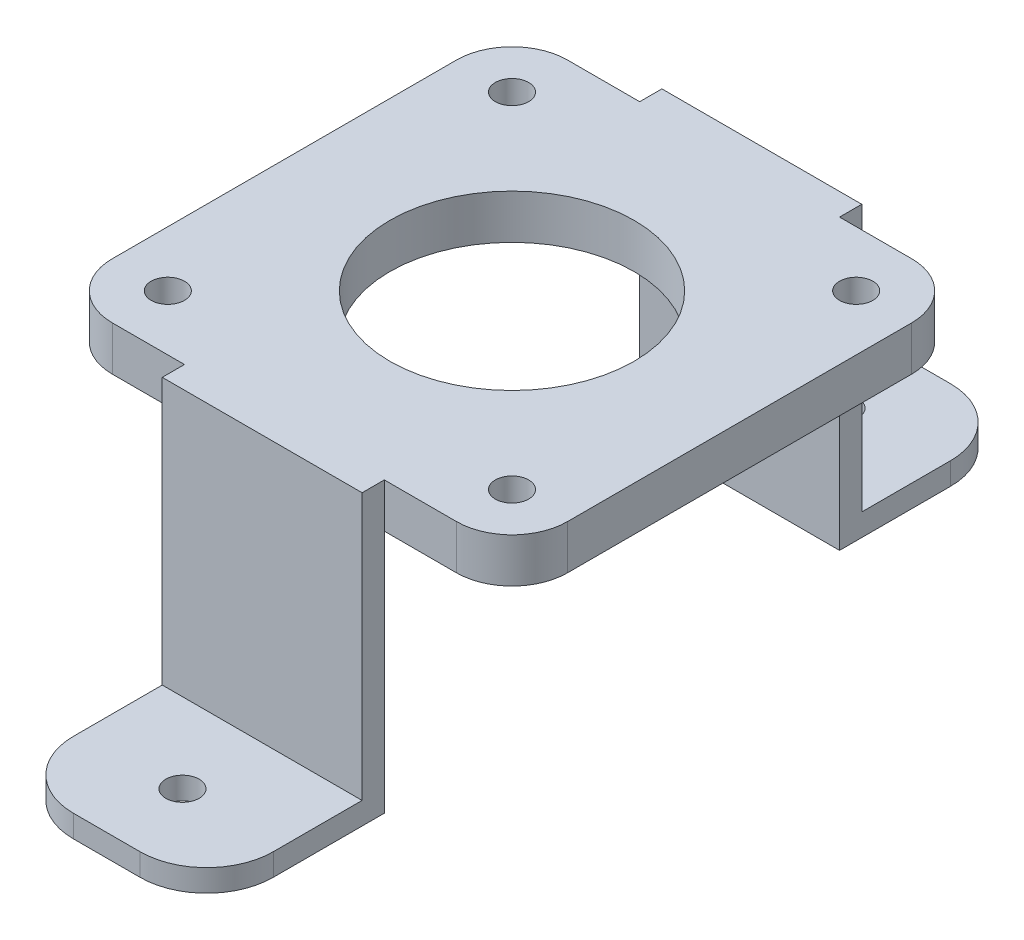
from build123d import *

# Parameters (mm, degrees)
SKETCH_2_R          = 11
SKETCH_2_R_2        = 1.5
EXTRUDE_1_DEPTH     = 4
SKETCH_3_W          = 18
SKETCH_3_H          = 26
EXTRUDE_2_DEPTH     = 2
EXTRUDE_3_DEPTH     = 2
SKETCH_5_R          = 1.5
CUT_EXTRUDE_1_DEPTH = 49.254533466


with BuildPart() as part:
    # Эскиз2 → Бобышка-Вытянуть1 (new body)
    with BuildSketch(Plane(origin=(0, 0, 0), x_dir=(1, 0, 0), z_dir=(0, 1, 0))):
        with BuildLine():
            Line((-15.5, -20.5), (15.5, -20.5))
            ThreePointArc((15.5, -20.5), (19.035533906, -19.035533906), (20.5, -15.5))
            Line((20.5, -15.5), (20.5, 15.5))
            ThreePointArc((20.5, 15.5), (19.035533906, 19.035533906), (15.5, 20.5))
            Line((15.5, 20.5), (-15.5, 20.5))
            ThreePointArc((-15.5, 20.5), (-19.035533906, 19.035533906), (-20.5, 15.5))
            Line((-20.5, 15.5), (-20.5, -15.5))
            ThreePointArc((-20.5, -15.5), (-19.035533906, -19.035533906), (-15.5, -20.5))
        make_face()
        Circle(SKETCH_2_R, mode=Mode.SUBTRACT)
        with Locations((-15.5, 15.5)):
            Circle(SKETCH_2_R_2, mode=Mode.SUBTRACT)
        with Locations((15.5, -15.5)):
            Circle(SKETCH_2_R_2, mode=Mode.SUBTRACT)
        with Locations((-15.5, -15.5)):
            Circle(SKETCH_2_R_2, mode=Mode.SUBTRACT)
        with Locations((15.5, 15.5)):
            Circle(SKETCH_2_R_2, mode=Mode.SUBTRACT)
    extrude(amount=EXTRUDE_1_DEPTH)

    # Эскиз3 → Бобышка-Вытянуть2 (add)
    with BuildSketch(Plane.XY.offset(20.5)):
        with Locations((0, -9)):
            Rectangle(SKETCH_3_W, SKETCH_3_H)
    extrude_2 = extrude(amount=EXTRUDE_2_DEPTH)

    # Эскиз4 → Бобышка-Вытянуть3 (add)
    with BuildSketch(Plane.XZ.offset(22)):
        with BuildLine():
            Line((9, 22.5), (-9, 22.5))
            Line((-9, 22.5), (-9, 30.5))
            ThreePointArc((-9, 30.5), (-7.242640687, 34.742640687), (-3, 36.5))
            Line((-3, 36.5), (3, 36.5))
            ThreePointArc((3, 36.5), (7.242640687, 34.742640687), (9, 30.5))
            Line((9, 30.5), (9, 22.5))
        make_face()
    extrude_3 = extrude(amount=-EXTRUDE_3_DEPTH)

    # Эскиз5 → Вырез-Вытянуть1 (cut, through all)
    with BuildSketch(Plane(origin=(0, -20, 0), x_dir=(1, 0, 0), z_dir=(0, 1, 0))):
        with Locations((0, -29.678729535)):
            Circle(SKETCH_5_R)
    cut_extrude_1 = extrude(amount=-CUT_EXTRUDE_1_DEPTH, mode=Mode.SUBTRACT)

    # Зеркальное отражение1: Бобышка-Вытянуть2, Бобышка-Вытянуть3, Вырез-Вытянуть1 across plane
    add(extrude_2.mirror(Plane.XY))
    add(extrude_3.mirror(Plane.XY))
    add(cut_extrude_1.mirror(Plane.XY), mode=Mode.SUBTRACT)


solid = part.part
